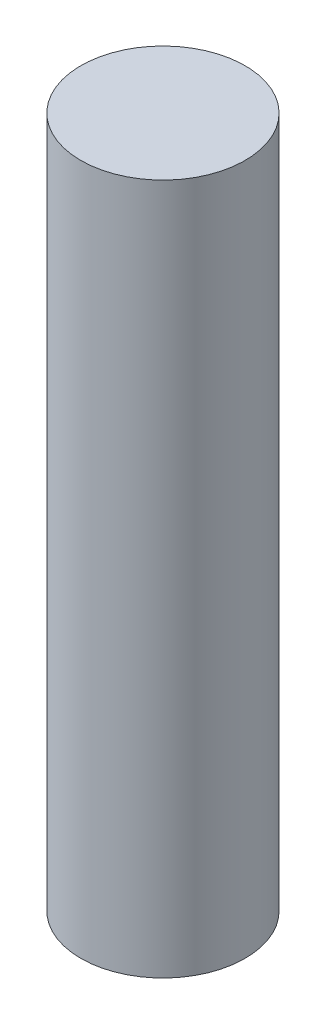
from build123d import *

# Parameters (mm, degrees)
SKETCH1_R           = 4
BOSS_EXTRUDE1_DEPTH = 33.655


with BuildPart() as part:
    # Sketch1 → Boss-Extrude1 (new body)
    with BuildSketch(Plane(origin=(0, 0, 0), x_dir=(1, 0, 0), z_dir=(0, 1, 0))):
        with Locations((-1.869568361, 3.172600856)):
            Circle(SKETCH1_R)
    extrude(amount=BOSS_EXTRUDE1_DEPTH)


solid = part.part
